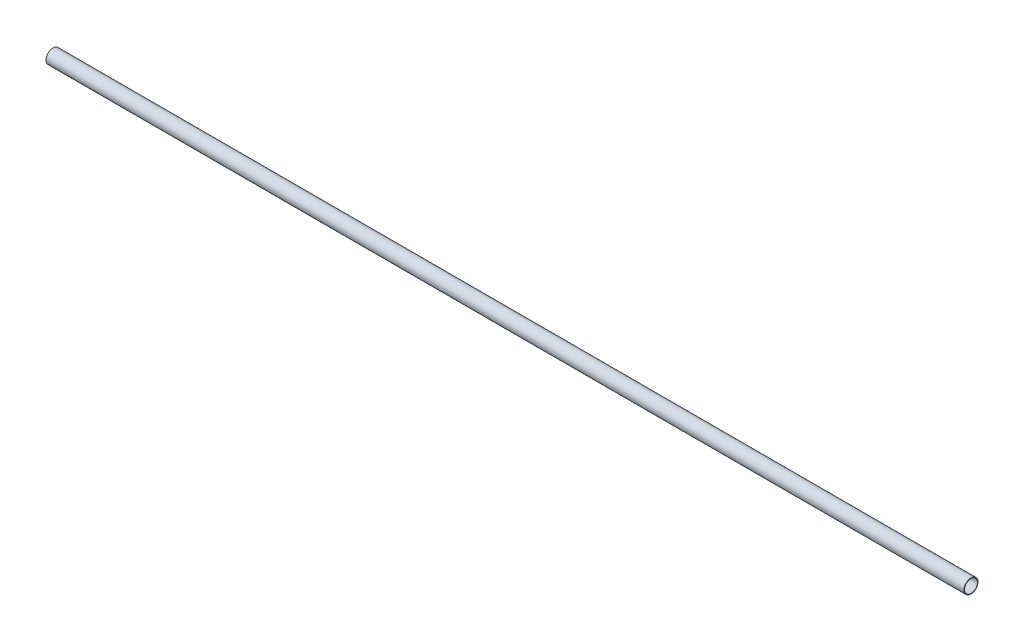
from build123d import *

# Parameters (mm, degrees)
SKETCH1_R           = 13
SKETCH1_R_2         = 12
BOSS_EXTRUDE1_DEPTH = 1700


with BuildPart() as part:
    # Sketch1 → Boss-Extrude1 (new body)
    with BuildSketch(Plane(origin=(0, 0, 0), x_dir=(0, 0, -1), z_dir=(1, 0, 0))):
        Circle(SKETCH1_R)
        Circle(SKETCH1_R_2, mode=Mode.SUBTRACT)
    extrude(amount=BOSS_EXTRUDE1_DEPTH)


solid = part.part
